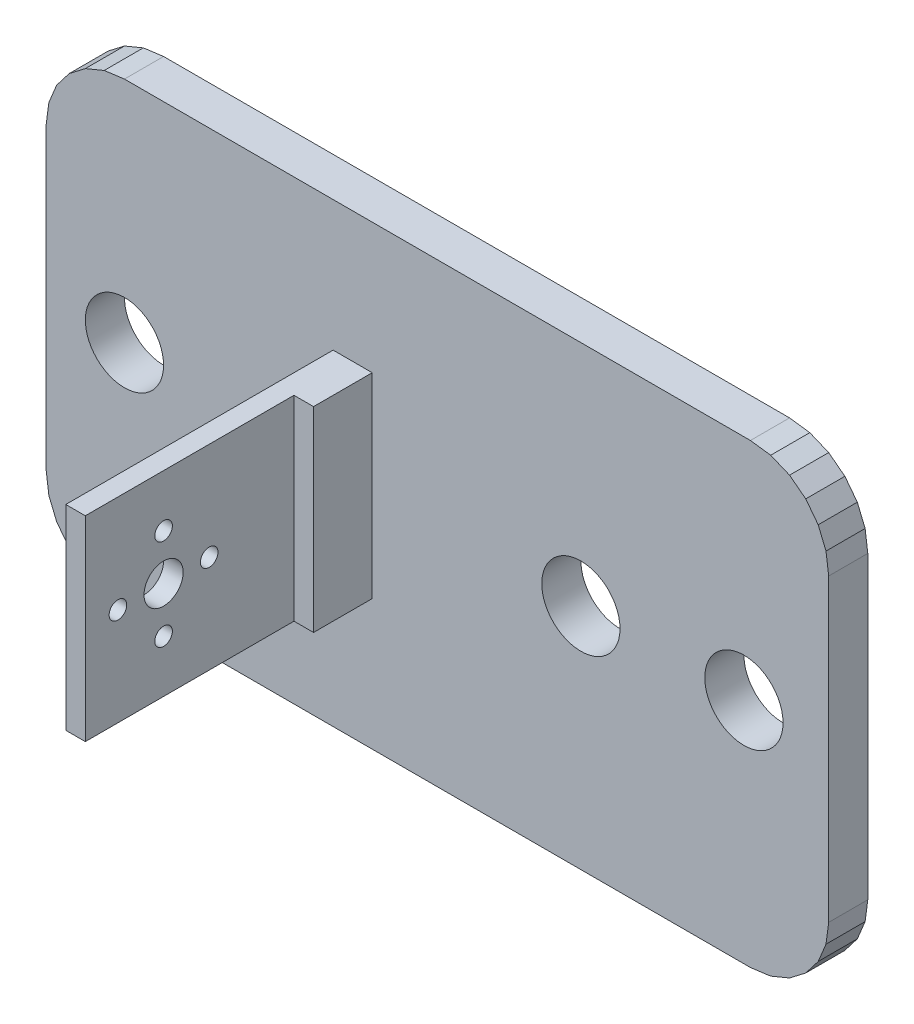
from build123d import *

# Parameters (mm, degrees)
S_BOX1_W      = 120
S_BOX1_H      = 70
BOSS_1_DEPTH  = 6
S_BOX2_W      = 3
S_BOX2_H      = 30
BOSS_2_DEPTH  = 41.5
S_BOX3_W      = 3.5
S_BOX3_H      = 30
BOSS_3_DEPTH  = 9.5
S_HOLE4_R     = 3
HOLE_4_DEPTH  = 3.2
S_HOLE5_R     = 1.35
HOLE_5_DEPTH  = 3.2
S_HOLE6_R     = 1.35
HOLE_6_DEPTH  = 3.2
S_HOLE7_R     = 1.35
HOLE_7_DEPTH  = 3.2
S_HOLE8_R     = 1.35
HOLE_8_DEPTH  = 3.2
S_HOLE9_R     = 6
HOLE_9_DEPTH  = 6.2
S_HOLE10_R    = 6
HOLE_10_DEPTH = 6.2
S_HOLE11_R    = 6
HOLE_11_DEPTH = 6.2
S_HOLE12_R    = 6
HOLE_12_DEPTH = 6.2
CUT_13_DEPTH  = 6.2
CUT_14_DEPTH  = 6.2
CUT_15_DEPTH  = 6.2
CUT_16_DEPTH  = 6.2


with BuildPart() as part:
    # S_box1 → Boss_1 (new body)
    with BuildSketch(Plane.XY.offset(-35)):
        with Locations((-2, 0)):
            Rectangle(S_BOX1_W, S_BOX1_H)
    extrude(amount=BOSS_1_DEPTH)

    # S_box2 → Boss_2 (add)
    with BuildSketch(Plane.XY.offset(-29.5)):
        with Locations((-16.5, 0)):
            Rectangle(S_BOX2_W, S_BOX2_H)
    extrude(amount=BOSS_2_DEPTH)

    # S_box3 → Boss_3 (add)
    with BuildSketch(Plane.XY.offset(-29.5)):
        with Locations((-13.75, 0)):
            Rectangle(S_BOX3_W, S_BOX3_H)
    extrude(amount=BOSS_3_DEPTH)

    # S_hole4 → Hole_4 (cut)
    with BuildSketch(Plane(origin=(-18.1, 0, 0), x_dir=(0, 0, -1), z_dir=(1, 0, 0))):
        Circle(S_HOLE4_R)
    extrude(amount=HOLE_4_DEPTH, mode=Mode.SUBTRACT)

    # S_hole5 → Hole_5 (cut)
    with BuildSketch(Plane(origin=(-18.1, 0, 0), x_dir=(0, 0, -1), z_dir=(1, 0, 0))):
        with Locations((0, 7)):
            Circle(S_HOLE5_R)
    extrude(amount=HOLE_5_DEPTH, mode=Mode.SUBTRACT)

    # S_hole6 → Hole_6 (cut)
    with BuildSketch(Plane(origin=(-18.1, 0, 0), x_dir=(0, 0, -1), z_dir=(1, 0, 0))):
        with Locations((-7, 0)):
            Circle(S_HOLE6_R)
    extrude(amount=HOLE_6_DEPTH, mode=Mode.SUBTRACT)

    # S_hole7 → Hole_7 (cut)
    with BuildSketch(Plane(origin=(-18.1, 0, 0), x_dir=(0, 0, -1), z_dir=(1, 0, 0))):
        with Locations((0, -7)):
            Circle(S_HOLE7_R)
    extrude(amount=HOLE_7_DEPTH, mode=Mode.SUBTRACT)

    # S_hole8 → Hole_8 (cut)
    with BuildSketch(Plane(origin=(-18.1, 0, 0), x_dir=(0, 0, -1), z_dir=(1, 0, 0))):
        with Locations((7, 0)):
            Circle(S_HOLE8_R)
    extrude(amount=HOLE_8_DEPTH, mode=Mode.SUBTRACT)

    # S_hole9 → Hole_9 (cut)
    with BuildSketch(Plane.XY.offset(-35.1)):
        with Locations((-50, 0)):
            Circle(S_HOLE9_R)
    extrude(amount=HOLE_9_DEPTH, mode=Mode.SUBTRACT)

    # S_hole10 → Hole_10 (cut)
    with BuildSketch(Plane.XY.offset(-35.1)):
        with Locations((-20, 0)):
            Circle(S_HOLE10_R)
    extrude(amount=HOLE_10_DEPTH, mode=Mode.SUBTRACT)

    # S_hole11 → Hole_11 (cut)
    with BuildSketch(Plane.XY.offset(-35.1)):
        with Locations((20, 0)):
            Circle(S_HOLE11_R)
    extrude(amount=HOLE_11_DEPTH, mode=Mode.SUBTRACT)

    # S_hole12 → Hole_12 (cut)
    with BuildSketch(Plane.XY.offset(-35.1)):
        with Locations((45, 0)):
            Circle(S_HOLE12_R)
    extrude(amount=HOLE_12_DEPTH, mode=Mode.SUBTRACT)

    # S_pcut13 → Cut_13 (cut)
    with BuildSketch(Plane.XY.offset(-35.1)):
        Polygon((58.6, 35.6), (46, 35.6), (46, 35), (49.106, 34.591), (52, 33.392), (54.485, 31.485), (56.392, 29), (57.591, 26.106), (58, 23), (58.6, 23), align=None)
    extrude(amount=CUT_13_DEPTH, mode=Mode.SUBTRACT)

    # S_pcut14 → Cut_14 (cut)
    with BuildSketch(Plane.XY.offset(-35.1)):
        Polygon((58.6, -35.6), (46, -35.6), (46, -35), (49.106, -34.591), (52, -33.392), (54.485, -31.485), (56.392, -29), (57.591, -26.106), (58, -23), (58.6, -23), align=None)
    extrude(amount=CUT_14_DEPTH, mode=Mode.SUBTRACT)

    # S_pcut15 → Cut_15 (cut)
    with BuildSketch(Plane.XY.offset(-35.1)):
        Polygon((-62.6, 35.6), (-50, 35.6), (-50, 35), (-53.106, 34.591), (-56, 33.392), (-58.485, 31.485), (-60.392, 29), (-61.591, 26.106), (-62, 23), (-62.6, 23), align=None)
    extrude(amount=CUT_15_DEPTH, mode=Mode.SUBTRACT)

    # S_pcut16 → Cut_16 (cut)
    with BuildSketch(Plane.XY.offset(-35.1)):
        Polygon((-62.6, -35.6), (-50, -35.6), (-50, -35), (-53.106, -34.591), (-56, -33.392), (-58.485, -31.485), (-60.392, -29), (-61.591, -26.106), (-62, -23), (-62.6, -23), align=None)
    extrude(amount=CUT_16_DEPTH, mode=Mode.SUBTRACT)


solid = part.part
